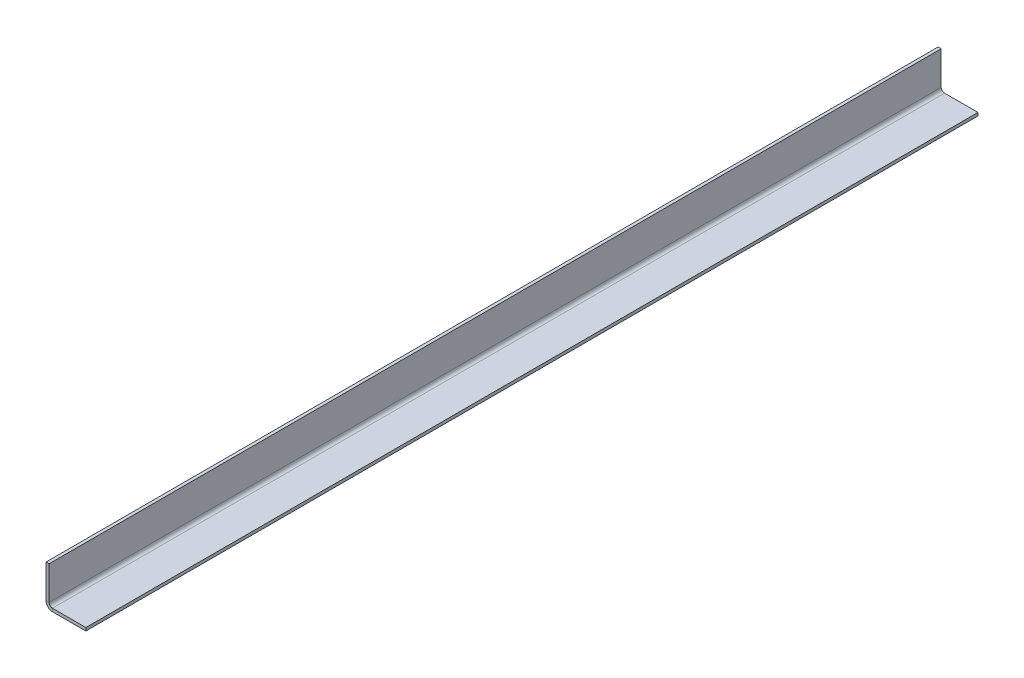
from build123d import *

# Parameters (mm, degrees)
SM_BASE_FLANGE_1_DEPTH = 291


# Sheet-metal steps are written as plain solids
with BuildPart() as part:
    # Sketch 1 → Базовая кромка1 (new body)
    with BuildSketch(Plane.XY):
        with BuildLine():
            Line((-26.892874013, 12), (-26.892874013, 1.1))
            ThreePointArc((-26.892874013, 1.1), (-26.570691472, 0.322182541), (-25.792874013, 0))
            Line((-25.792874013, 0), (-14.892874013, 0))
            Line((-14.892874013, 0), (-14.892874013, -1))
            Line((-14.892874013, -1), (-25.792874013, -1))
            ThreePointArc((-25.792874013, -1), (-27.277798253, -0.38492424), (-27.892874013, 1.1))
            Line((-27.892874013, 1.1), (-27.892874013, 12))
            Line((-27.892874013, 12), (-26.892874013, 12))
        make_face()
    extrude(amount=SM_BASE_FLANGE_1_DEPTH)


solid = part.part
